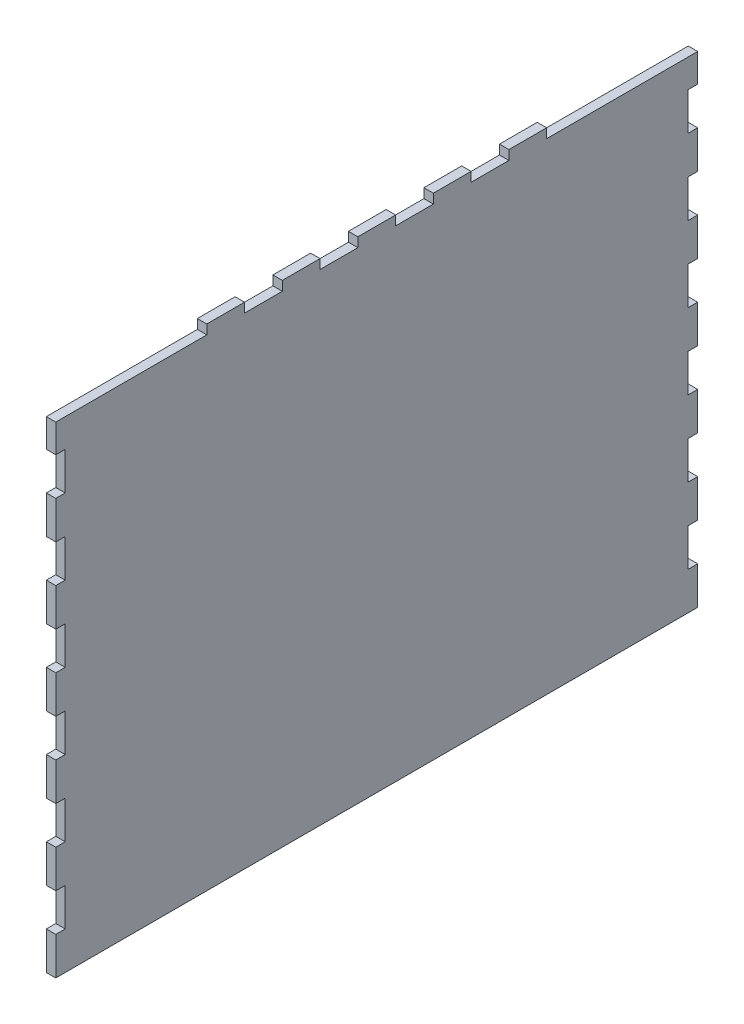
from build123d import *

# Parameters (mm, degrees)
BOSS_EXTRUDE1_DEPTH = 1.5875
CUT_EXTRUDE1_DEPTH  = 3.175


with BuildPart() as part:
    # Sketch1 → Boss-Extrude1 (new, symmetric)
    with BuildSketch(Plane(origin=(0, 0, 0), x_dir=(0, 0, -1), z_dir=(1, 0, 0))):
        Polygon((-107.95, 69.85), (-104.775, 69.85), (-104.775, 57.15), (-107.95, 57.15), (-107.95, 44.45), (-104.775, 44.45), (-104.775, 31.75), (-107.95, 31.75), (-107.95, 19.05), (-104.775, 19.05), (-104.775, 6.35), (-107.95, 6.35), (-107.95, -6.35), (-104.775, -6.35), (-104.775, -19.05), (-107.95, -19.05), (-107.95, -31.75), (-104.775, -31.75), (-104.775, -44.45), (-107.95, -44.45), (-107.95, -57.15), (-104.775, -57.15), (-104.775, -69.85), (-107.95, -69.85), (-107.95, -82.55), (107.95, -82.55), (107.95, -69.85), (104.775, -69.85), (104.775, -57.15), (107.95, -57.15), (107.95, -44.45), (104.775, -44.45), (104.775, -31.75), (107.95, -31.75), (107.95, -19.05), (104.775, -19.05), (104.775, -6.35), (107.95, -6.35), (107.95, 6.35), (104.775, 6.35), (104.775, 19.05), (107.95, 19.05), (107.95, 31.75), (104.775, 31.75), (104.775, 44.45), (107.95, 44.45), (107.95, 57.15), (104.775, 57.15), (104.775, 69.85), (107.95, 69.85), (107.95, 82.55), (-107.95, 82.55), align=None)
    extrude(amount=BOSS_EXTRUDE1_DEPTH, both=True)

    # Sketch2 → Cut-Extrude1 (cut)
    with BuildSketch(Plane(origin=(0, 82.55, 0), x_dir=(1, 0, 0), z_dir=(0, 1, 0))):
        Polygon((-1.5875, -19.05), (1.5875, -19.05), (1.5875, -6.35), (-1.5875, -6.35), (-1.5875, 6.35), (1.5875, 6.35), (1.5875, 19.05), (-1.5875, 19.05), (-1.5875, 31.75), (1.5875, 31.75), (1.5875, 44.45), (-1.5875, 44.45), (-1.5875, 57.15), (1.5875, 57.15), (1.5875, 57.409968687), (1.5875, 107.95), (-5.773164328, 107.95), (-5.773164328, -107.95), (1.5875, -107.95), (1.5875, -57.15), (-1.5875, -57.15), (-1.5875, -44.45), (1.5875, -44.45), (1.5875, -31.75), (-1.5875, -31.75), align=None)
    extrude(amount=-CUT_EXTRUDE1_DEPTH, mode=Mode.SUBTRACT)


solid = part.part
